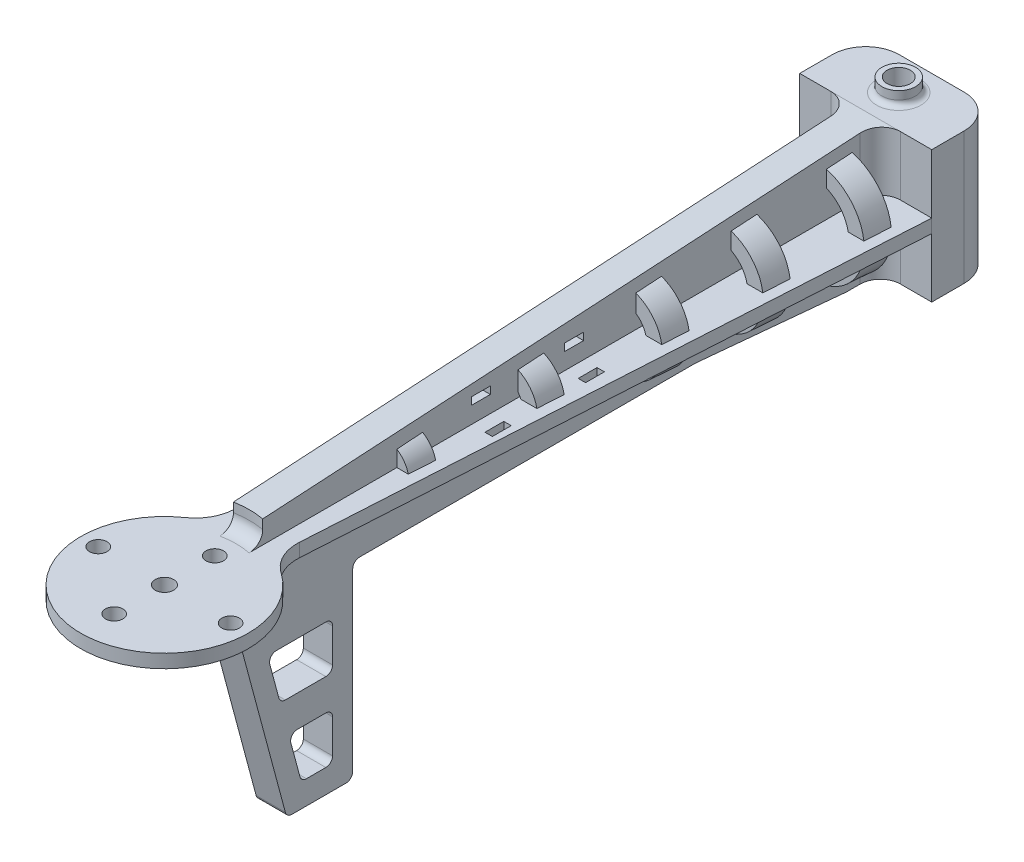
from build123d import *

# Parameters (mm, degrees)
SKETCH1_W                     = 24.94534
SKETCH1_H                     = 24.94534
BOSS_EXTRUDE1_DEPTH           = 12.47267
SKETCH2_W                     = 3.556
SKETCH2_H                     = 1.397
BOSS_EXTRUDE2_DEPTH           = 2.762779167
SKETCH3_W                     = 1.397
SKETCH3_H                     = 3.556
BOSS_EXTRUDE3_DEPTH           = 1.27
FILLET1_R                     = 6.35
SKETCH5_R                     = 15.8250001
BOSS_EXTRUDE4_DEPTH           = 1.27
SKETCH6_R                     = 13.97
CUT_EXTRUDE2_DEPTH            = 169.188371173
SKETCH25_R                    = 1.749997008
CUT_EXTRUDE8_DEPTH            = 169.188371173
SKETCH26_R                    = 1.6499967
CUT_EXTRUDE9_DEPTH            = 169.188371173
FILLET6_R                     = 7.62
BOSS_EXTRUDE6_REACH           = 169.499
SKETCH22_R                    = 6.35
SKETCH9_R                     = 3.175
BOSS_EXTRUDE5_DEPTH           = 2.54
CBORE_FOR_M3_SHCS1_AT_2_COUNT = 2
CBORE_FOR_M3_SHCS1_AT_2_PITCH = 18.9999874
FILLET9_R                     = 1
SKETCH16_R                    = 2.200000045
CUT_EXTRUDE3_DEPTH            = 173.519531949
SKETCH23_W                    = 31.6500002
SKETCH23_H                    = 25.4
CUT_EXTRUDE6_DEPTH            = 168.499092713
FILLET13_R                    = 3.81
FILLET14_R                    = 3.81
FILLET15_R                    = 3.81
FILLET16_R                    = 3.81
FILLET20_START                = 103
FILLET20_DEPTH                = 28
SKETCH28_W                    = 28.2999942
SKETCH28_H                    = 101.6
CUT_EXTRUDE11_DEPTH           = 169.188371306
SKETCH29_R                    = 16.039973
CUT_EXTRUDE12_DEPTH           = 169.188371306
FILLET21_R                    = 2.54


with BuildPart() as part:
    # Sketch1 → Boss-Extrude1 (new body)
    with BuildSketch(Plane.XY):
        Rectangle(SKETCH1_W, SKETCH1_H)
    extrude(amount=BOSS_EXTRUDE1_DEPTH)

    # Sketch2 → Boss-Extrude2 (add, symmetric)
    with BuildSketch(Plane(origin=(0, 0, 0), x_dir=(0, 0, -1), z_dir=(1, 0, 0))):
        with BuildLine():
            Line((-12.47267, 12.47267), (-160.32607, 3.696335))
            Line((-160.32607, 3.696335), (-160.32607, -3.696335))
            Line((-160.32607, -3.696335), (-135.767397092, -6.929545626))
            ThreePointArc((-135.767397092, -6.929545626), (-135.095796171, -7.233844044), (-134.706439557, -7.859980412))
            Line((-134.706439557, -7.859980412), (-124.8602731, -44.606373887))
            ThreePointArc((-124.8602731, -44.606373887), (-124.406674316, -45.285232442), (-123.633547301, -45.5476737))
            Line((-123.633547301, -45.5476737), (-113.405382576, -45.5476737))
            ThreePointArc((-113.405382576, -45.5476737), (-112.507356963, -45.175699312), (-112.135382576, -44.2776737))
            Line((-112.135382576, -44.2776737), (-112.135382576, -11.1176689))
            ThreePointArc((-112.135382576, -11.1176689), (-111.763408188, -10.219643288), (-110.865382576, -9.8476689))
            Line((-110.865382576, -9.8476689), (-47.365382576, -9.8476689))
            Line((-47.365382576, -9.8476689), (-18.82267, -12.47267))
            Line((-18.82267, -12.47267), (-12.47267, -12.47267))
            Line((-12.47267, -12.47267), (-12.47267, 12.47267))
        make_face()
        with Locations((-70.310049242, 5.1053111)):
            Rectangle(SKETCH2_W, SKETCH2_H, mode=Mode.SUBTRACT)
        with Locations((-87.920715909, 5.1053111)):
            Rectangle(SKETCH2_W, SKETCH2_H, mode=Mode.SUBTRACT)
        with BuildLine():
            Line((-115.945382576, -18.5551699), (-115.945382576, -24.9401711))
            ThreePointArc((-115.945382576, -24.9401711), (-116.317356963, -25.838196712), (-117.215382576, -26.2101711))
            Line((-117.215382576, -26.2101711), (-124.870613259, -26.2101711))
            ThreePointArc((-124.870613259, -26.2101711), (-125.643740274, -25.947729842), (-126.097339058, -25.268871287))
            Line((-126.097339058, -25.268871287), (-127.808194973, -18.883870087))
            ThreePointArc((-127.808194973, -18.883870087), (-127.589027916, -17.782042885), (-126.581469174, -17.2851699))
            Line((-126.581469174, -17.2851699), (-117.215382576, -17.2851699))
            ThreePointArc((-117.215382576, -17.2851699), (-116.317356963, -17.657144288), (-115.945382576, -18.5551699))
        make_face(mode=Mode.SUBTRACT)
        with BuildLine():
            Line((-115.945382576, -33.4301719), (-115.945382576, -39.8151731))
            ThreePointArc((-115.945382576, -39.8151731), (-116.317356963, -40.713198712), (-117.215382576, -41.0851731))
            Line((-117.215382576, -41.0851731), (-120.884868485, -41.0851731))
            ThreePointArc((-120.884868485, -41.0851731), (-121.6579955, -40.822731842), (-122.111594285, -40.143873287))
            Line((-122.111594285, -40.143873287), (-123.8224502, -33.758872087))
            ThreePointArc((-123.8224502, -33.758872087), (-123.603283143, -32.657044885), (-122.595724401, -32.1601719))
            Line((-122.595724401, -32.1601719), (-117.215382576, -32.1601719))
            ThreePointArc((-117.215382576, -32.1601719), (-116.317356963, -32.532146288), (-115.945382576, -33.4301719))
        make_face(mode=Mode.SUBTRACT)
    extrude(amount=BOSS_EXTRUDE2_DEPTH, both=True)

    # Sketch3 → Boss-Extrude3 (add, symmetric)
    with BuildSketch(Plane(origin=(0, 0, 0), x_dir=(1, 0, 0), z_dir=(0, 1, 0))):
        Polygon((-12.47267, -12.47267), (12.47267, -12.47267), (3.696335, -160.32607), (-3.696335, -160.32607), align=None)
        with Locations((6.001279167, -70.310049242)):
            Rectangle(SKETCH3_W, SKETCH3_H, mode=Mode.SUBTRACT)
        with Locations((6.001279167, -87.920715909)):
            Rectangle(SKETCH3_W, SKETCH3_H, mode=Mode.SUBTRACT)
        with Locations((-6.001279167, -87.920715909)):
            Rectangle(SKETCH3_W, SKETCH3_H, mode=Mode.SUBTRACT)
        with Locations((-6.001279167, -70.310049242)):
            Rectangle(SKETCH3_W, SKETCH3_H, mode=Mode.SUBTRACT)
    extrude(amount=BOSS_EXTRUDE3_DEPTH, both=True)

    # Fillet1
    fillet1_edges = [part.edges().sort_by_distance(p)[0] for p in [
        (-12.47267, 0, 0),
        (12.47267, 0, 0),
    ]]
    fillet(fillet1_edges, radius=FILLET1_R)

    # Sketch5 → Boss-Extrude4 (add, symmetric)
    with BuildSketch(Plane(origin=(0, 0, 0), x_dir=(1, 0, 0), z_dir=(0, 1, 0))):
        with Locations((0, -144.938811123)):
            Circle(SKETCH5_R)
    extrude(amount=BOSS_EXTRUDE4_DEPTH, both=True)

    # Sketch6 → Cut-Extrude2 (cut, through all)
    with BuildSketch(Plane(origin=(0, 1.27, 0), x_dir=(1, 0, 0), z_dir=(0, 1, 0))):
        with Locations((0, -144.938811123)):
            Circle(SKETCH6_R)
    extrude(amount=CUT_EXTRUDE2_DEPTH, mode=Mode.SUBTRACT)

    # Sketch25 → Cut-Extrude8 (cut, through all)
    with BuildSketch(Plane(origin=(0, 1.27, 0), x_dir=(1, 0, 0), z_dir=(0, 1, 0))):
        with Locations(Location((0, -144.938811123, 0), (0, 0, 270))):
            Circle(SKETCH25_R)
    extrude(amount=-CUT_EXTRUDE8_DEPTH, mode=Mode.SUBTRACT)

    # Sketch26 → Cut-Extrude9 (cut, through all)
    with BuildSketch(Plane(origin=(0, 1.27, 0), x_dir=(1, 0, 0), z_dir=(0, 1, 0))):
        with Locations(Location((12.5000004, -144.938811123, 0), (0, 0, 270))):
            Circle(SKETCH26_R)
        with Locations(Location((-12.5000004, -144.938811123, 0), (0, 0, 90))):
            Circle(SKETCH26_R)
        with Locations(Location((0, -135.438817423, 0), (0, 0, 270))):
            Circle(SKETCH26_R)
        with Locations(Location((0, -154.438804823, 0), (0, 0, 270))):
            Circle(SKETCH26_R)
    extrude(amount=-CUT_EXTRUDE9_DEPTH, mode=Mode.SUBTRACT)

    # Fillet6
    fillet6_edges = [part.edges().sort_by_distance(p)[0] for p in [
        (5.490690133, 0, 130.096878971),
        (-5.490690133, 0, 130.096878971),
    ]]
    fillet(fillet6_edges, radius=FILLET6_R)

    # Boss-Extrude6: up to this plane
    boss_extrude6_end = Plane(origin=(2.762779167, -6.929545626, 135.767397092), z_dir=(0, 0.9914448613738104, -0.13052619222005185))
    # Sketch22 → Boss-Extrude6 (add, up to the surface)
    with BuildSketch(Plane.XZ.offset(1.27), mode=Mode.PRIVATE) as boss_extrude6_sk1:
        with Locations((0, 135.438817423)):
            Circle(SKETCH22_R)
    boss_extrude6_tool1 = split(extrude(boss_extrude6_sk1.sketch, amount=BOSS_EXTRUDE6_REACH, mode=Mode.PRIVATE), bisect_by=boss_extrude6_end, keep=Keep.BOTH, mode=Mode.PRIVATE)
    add(boss_extrude6_tool1.solids().sort_by_distance((0, -1.27, 135.438817))[0])

    # Sketch9 → Boss-Extrude5 (add)
    with BuildSketch(Plane(origin=(0, 12.47267, 0), x_dir=(1, 0, 0), z_dir=(0, 1, 0))):
        with Locations(Location((0, -6.236335, 0), (0, 0, 90))):
            Circle(SKETCH9_R)
    boss_extrude5 = extrude(amount=BOSS_EXTRUDE5_DEPTH)

    # Mirror1: Boss-Extrude5 across plane
    add(boss_extrude5.mirror(Plane.ZX))

    # Sketch14 → CBORE for M3 SHCS1 (revolve, cut)
    with BuildSketch(Plane(origin=(0, -1.27, 154.438804823), x_dir=(0, 0, 1), z_dir=(1, 0, 0))):
        Polygon((0, 0), (0, 44.2776737), (1.7, 44.2776737), (1.7, 13), (3.75, 13), (3.75, 0), align=None)
    cbore_for_m3_shcs1 = revolve(axis=Axis((0, 5.08, 154.438804823), (0, -1, 0)), mode=Mode.SUBTRACT)

    # CBORE for M3 SHCS1 at 2: CBORE for M3 SHCS1 ×2
    with Locations(*[(0, 0, -i * CBORE_FOR_M3_SHCS1_AT_2_PITCH) for i in range(1, CBORE_FOR_M3_SHCS1_AT_2_COUNT)]):
        add(cbore_for_m3_shcs1, mode=Mode.SUBTRACT)

    # Fillet9
    fillet9_edges = [part.edges().sort_by_distance(p)[0] for p in [
        (0, 12.47267, 9.411335),
        (0, -12.47267, 9.411335),
    ]]
    fillet(fillet9_edges, radius=FILLET9_R)

    # Sweep1: sweep along a path in Sketch19
    with BuildLine(Plane.XY.offset(49.284466667)) as sweep1_path:
        CenterArc((0, 0), 20.682824309, 0, 360)
    # Sketch20 → Sweep1 (sweep)
    with BuildSketch(Plane(origin=(0, 0, 0), x_dir=(1, 0, 0), z_dir=(0, 1, 0))):
        Polygon((-5.910523281, -35.795894242), (-9.128840166, -35.795894242), (-8.840294219, -40.656977992), (-5.910523281, -40.656977992), align=None)
        Polygon((-8.059681361, -53.807827992), (-4.841364475, -53.807827992), (-4.841364475, -58.668911742), (-7.771135413, -58.668911742), align=None)
        Polygon((-10.197998972, -17.783960492), (-6.979682087, -17.783960492), (-6.979682087, -22.645044242), (-9.909453024, -22.645044242), align=None)
        Polygon((-5.380736261, -98.939553409), (-2.162419376, -98.939553409), (-2.162419376, -103.800637159), (-5.092190313, -103.800637159), align=None)
        Polygon((-6.739018967, -76.056799242), (-3.520702082, -76.056799242), (-3.520702082, -80.917882992), (-6.450473019, -80.917882992), align=None)
    sweep(path=sweep1_path.line)

    # Sketch16 → Cut-Extrude3 (cut, through all)
    with BuildSketch(Plane(origin=(0, 15.01267, 0), x_dir=(1, 0, 0), z_dir=(0, 1, 0))):
        with Locations(Location((0, -6.236335, 0), (0, 0, 270))):
            Circle(SKETCH16_R)
    extrude(amount=-CUT_EXTRUDE3_DEPTH, mode=Mode.SUBTRACT)

    # Sketch23 → Cut-Extrude6 (cut, through all)
    with BuildSketch(Plane.XZ.offset(1.27)):
        with Locations((0, 157.638811123)):
            Rectangle(SKETCH23_W, SKETCH23_H)
    extrude(amount=CUT_EXTRUDE6_DEPTH, mode=Mode.SUBTRACT)

    # Fillet13
    fillet13_edges = [part.edges().sort_by_distance(p)[0] for p in [
        (-2.762779167, -6.871335, 12.47267),
    ]]
    fillet(fillet13_edges, radius=FILLET13_R)

    # Fillet14
    # the kernel refuses this fillet: 3.81 mm, written as the material it adds along each edge
    with BuildSketch(Plane(origin=(-2.762779167, -8.255, 12.47267), x_dir=(-1, 0, 0), z_dir=(0, 1, 0))) as fillet14_piece_1_section:
        with BuildLine():
            CenterArc((FILLET14_R, FILLET14_R), FILLET14_R, 180, 90)
            Line((0, FILLET14_R), (0, 0))
            Line((0, 0), (FILLET14_R, 0))
        make_face()
    fillet14_piece_1 = extrude(amount=20.72767, mode=Mode.PRIVATE)
    fillet14_piece_1 = split(fillet14_piece_1, bisect_by=Plane(origin=(-2.762779167, 12.399894244, 13.6987106), z_dir=(0, -0.9982429344791794, -0.059254061146868105)), keep=Keep.TOP, mode=Mode.PRIVATE)
    add(fillet14_piece_1)

    # Fillet15
    # the kernel refuses this fillet: 3.81 mm, written as the material it adds along each edge
    with BuildSketch(Plane(origin=(2.762779167, 1.27, 12.47267), x_dir=(0, 0, 1), z_dir=(0, 1, 0))) as fillet15_piece_1_section:
        with BuildLine():
            CenterArc((FILLET15_R, FILLET15_R), FILLET15_R, 180, 90)
            Line((0, FILLET15_R), (0, 0))
            Line((0, 0), (FILLET15_R, 0))
        make_face()
    fillet15_piece_1 = extrude(amount=20.72767, mode=Mode.PRIVATE)
    fillet15_piece_1 = split(fillet15_piece_1, bisect_by=Plane(origin=(2.762779167, 12.433336935, 13.135307347), z_dir=(0, -0.9982429344791794, -0.059254061146868105)), keep=Keep.TOP, mode=Mode.PRIVATE)
    add(fillet15_piece_1)

    # Fillet16
    fillet16_edges = [part.edges().sort_by_distance(p)[0] for p in [
        (2.762779167, -6.871335, 12.47267),
    ]]
    fillet(fillet16_edges, radius=FILLET16_R)

    # Fillet20: read off the stored shape, not the designer's step
    # Fillet20 outline → Fillet20 (add)
    with BuildSketch(Plane.XY.offset(FILLET20_START)):
        with BuildLine():
            add(Edge.make_bspline(
                [(3.524779167, -1.27), (2.762779167, -1.27), (2.762779167, -2.032)],
                knots=[0, 0, 0, 1, 1, 1], degree=2, weights=[1, 0.707106781, 1]))
            Line((3.524779167, -1.27), (2.762779167, -1.27))
            Line((2.762779167, -1.27), (2.762779167, -2.032))
        make_face()
    extrude(amount=FILLET20_DEPTH)

    # Sketch28 → Cut-Extrude11 (cut, through all)
    with BuildSketch(Plane(origin=(0, 1.27, 0), x_dir=(1, 0, 0), z_dir=(0, 1, 0))):
        with Locations((0, -197.488808131)):
            Rectangle(SKETCH28_W, SKETCH28_H)
    extrude(amount=CUT_EXTRUDE11_DEPTH, mode=Mode.SUBTRACT)

    # Sketch29 → Cut-Extrude12 (cut, through all)
    with BuildSketch(Plane(origin=(0, 1.27, 0), x_dir=(1, 0, 0), z_dir=(0, 1, 0))):
        with Locations((0, -144.938811123)):
            Circle(SKETCH29_R)
    extrude(amount=CUT_EXTRUDE12_DEPTH, mode=Mode.SUBTRACT)

    # Fillet21
    # the kernel refuses this fillet: 2.54 mm, written as the material it adds along each edge
    with BuildSketch(Plane(origin=(0, 1.27, 144.938811123), x_dir=(0.5387901408413142, 0, -0.8424400181212884), z_dir=(0.8424400181212884, 0, 0.5387901408413142))) as fillet21_piece_1_section:
        with BuildLine():
            CenterArc((16.039973 - FILLET21_R, FILLET21_R), FILLET21_R, 270, 90)
            Line((16.039973, FILLET21_R), (16.039973, 0))
            Line((16.039973, 0), (16.039973 - FILLET21_R, 0))
        make_face()
    fillet21_piece_1 = revolve(axis=Axis((0, 1.27, 144.938811123), (0, 1, 0)), revolution_arc=65.202632827, mode=Mode.PRIVATE)
    fillet21_piece_1 = split(fillet21_piece_1, bisect_by=Plane(origin=(-2.762779167, 1.27, 144.938811123), z_dir=(1, 0, 0)), keep=Keep.TOP, mode=Mode.PRIVATE)
    fillet21_piece_1 = split(fillet21_piece_1, bisect_by=Plane(origin=(2.762779167, 1.27, 144.938811123), z_dir=(-1, 0, 0)), keep=Keep.TOP, mode=Mode.PRIVATE)
    add(fillet21_piece_1)


solid = part.part
